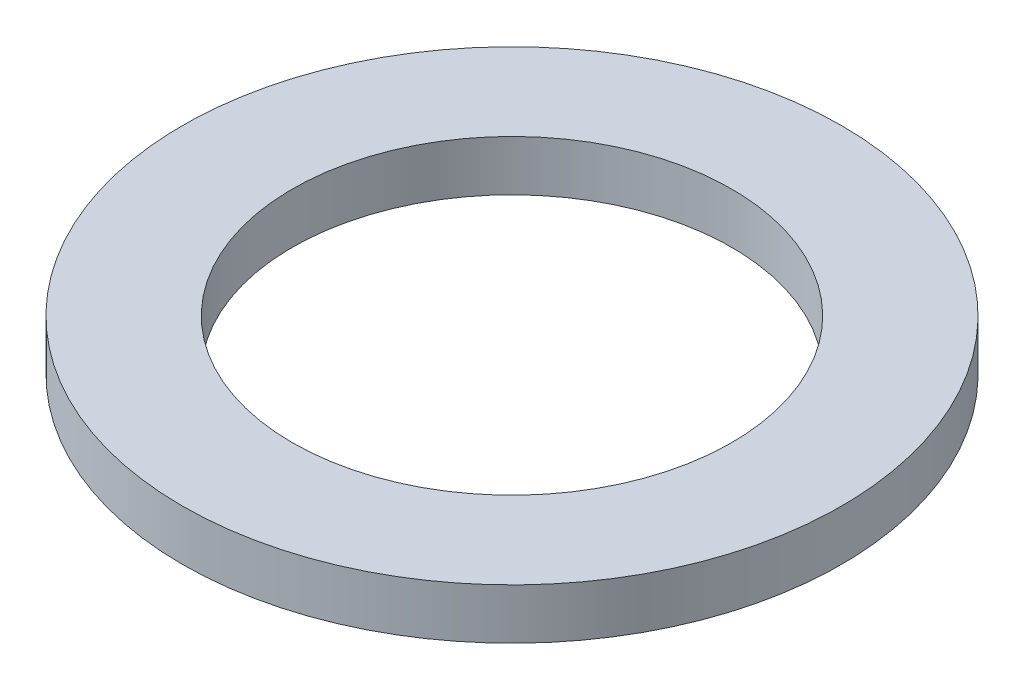
from build123d import *

# Parameters (mm, degrees)
ESQUISSE1_R        = 15
ESQUISSE1_R_2      = 10
BOSS_EXTRU_1_DEPTH = 2.3


with BuildPart() as part:
    # Esquisse1 → Boss.-Extru.1 (new body)
    with BuildSketch(Plane(origin=(0, 0, 0), x_dir=(1, 0, 0), z_dir=(0, 1, 0))):
        Circle(ESQUISSE1_R)
        Circle(ESQUISSE1_R_2, mode=Mode.SUBTRACT)
    extrude(amount=BOSS_EXTRU_1_DEPTH)


solid = part.part
